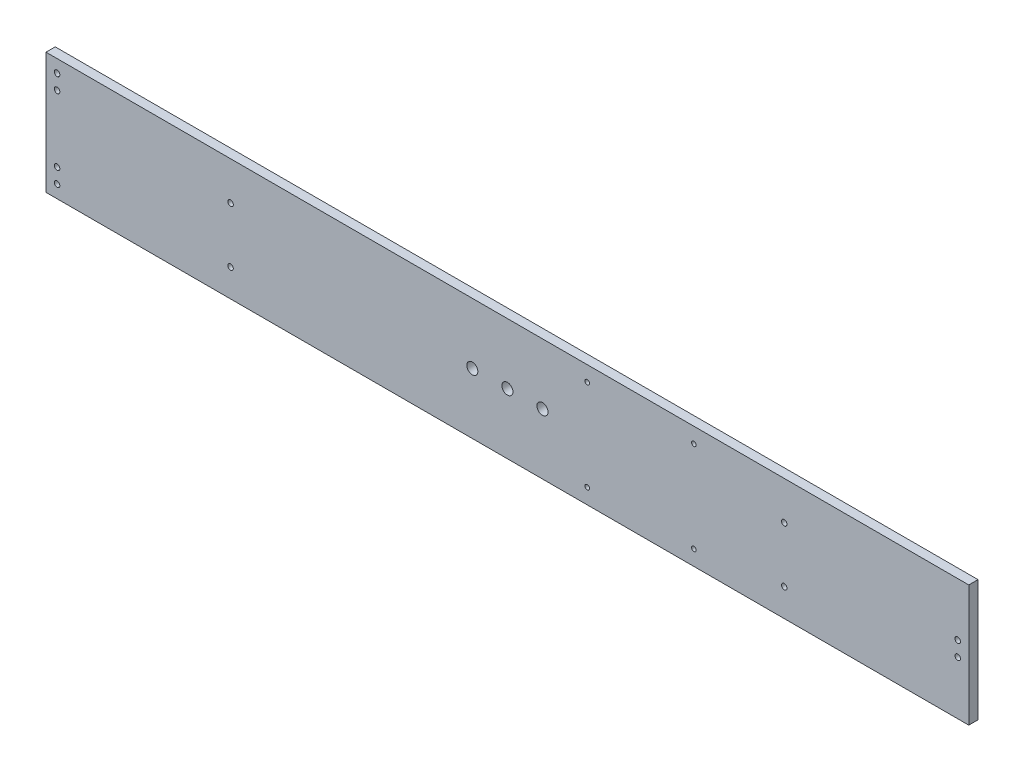
from build123d import *

# Parameters (mm, degrees)
SKETCH_3_W          = 500
SKETCH_3_H          = 65.8
SKETCH_3_R          = 1.25
SKETCH_3_R_2        = 3
EXTRUDE_2_DEPTH     = 5
SKETCH_4_R          = 1.5
CUT_EXTRUDE_1_DEPTH = 5
SKETCH_5_R          = 1.5
CUT_EXTRUDE_2_DEPTH = 5
SKETCH_6_R          = 3
CUT_EXTRUDE_3_DEPTH = 10


with BuildPart() as part:
    # 草图3 → 凸台-拉伸2 (new body)
    with BuildSketch(Plane.XY):
        Rectangle(SKETCH_3_W, SKETCH_3_H)
        with Locations((43.25, 24.65)):
            Circle(SKETCH_3_R, mode=Mode.SUBTRACT)
        with Locations((43.25, -24.65)):
            Circle(SKETCH_3_R, mode=Mode.SUBTRACT)
        with Locations((101.05, -24.65)):
            Circle(SKETCH_3_R, mode=Mode.SUBTRACT)
        with Locations((101.05, 24.65)):
            Circle(SKETCH_3_R, mode=Mode.SUBTRACT)
        Circle(SKETCH_3_R_2, mode=Mode.SUBTRACT)
    extrude(amount=EXTRUDE_2_DEPTH)

    # 草图4 → 切除-拉伸1 (cut)
    with BuildSketch(Plane.XY.offset(5)):
        with Locations((150, 12.1)):
            Circle(SKETCH_4_R)
        with Locations((150, -17.9)):
            Circle(SKETCH_4_R)
        with Locations((-150, -17.9)):
            Circle(SKETCH_4_R)
        with Locations((-150, 12.1)):
            Circle(SKETCH_4_R)
    extrude(amount=-CUT_EXTRUDE_1_DEPTH, mode=Mode.SUBTRACT)

    # 草图5 → 切除-拉伸2 (cut)
    with BuildSketch(Plane.XY.offset(5)):
        with Locations((-244, 26)):
            Circle(SKETCH_5_R)
        with Locations((-244, 18)):
            Circle(SKETCH_5_R)
        with Locations((-244, -18)):
            Circle(SKETCH_5_R)
        with Locations((-244, -26)):
            Circle(SKETCH_5_R)
        with Locations((244, -4)):
            Circle(SKETCH_5_R)
        with Locations((244, 4)):
            Circle(SKETCH_5_R)
    extrude(amount=-CUT_EXTRUDE_2_DEPTH, mode=Mode.SUBTRACT)

    # 草图6 → 切除-拉伸3 (cut)
    with BuildSketch(Plane.XY.offset(5)):
        with Locations((19, 0)):
            Circle(SKETCH_6_R)
        with Locations((-19, 0)):
            Circle(SKETCH_6_R)
    extrude(amount=-CUT_EXTRUDE_3_DEPTH, mode=Mode.SUBTRACT)


solid = part.part
